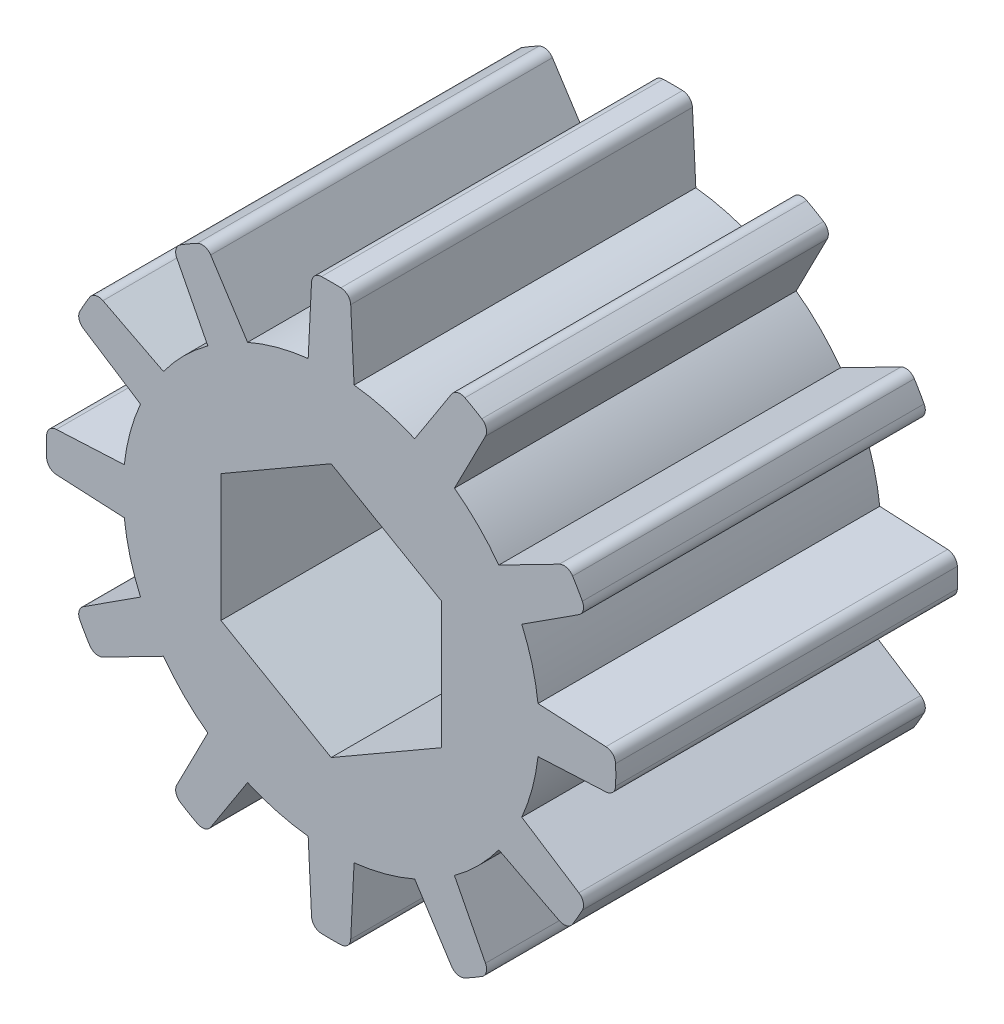
from build123d import *

# Parameters (mm, degrees)
CROQUIS1_R              = 1.85
SALIENTE_EXTRUIR1_DEPTH = 6.7
CORTAR_EXTRUIR3_DEPTH   = 11.352474398
REDONDEO1_R             = 0.2


with BuildPart() as part:
    # Croquis1 → Saliente-Extruir1 (new body)
    with BuildSketch(Plane.XY):
        with BuildLine():
            Line((0.375, 5.567875544), (0.45, 4.055600396))
            ThreePointArc((0.45, 4.055600396), (1.056108396, 3.941450193), (1.638088766, 3.737252971))
            Line((1.638088766, 3.737252971), (2.459178246, 5.009421667))
            ThreePointArc((2.459178246, 5.009421667), (2.790244751, 4.832845674), (3.108697299, 4.634421667))
            Line((3.108697299, 4.634421667), (2.41751163, 3.287252971))
            ThreePointArc((2.41751163, 3.287252971), (2.885341797, 2.885341797), (3.287252971, 2.41751163))
            Line((3.287252971, 2.41751163), (4.634421667, 3.108697299))
            ThreePointArc((4.634421667, 3.108697299), (4.832845674, 2.790244751), (5.009421667, 2.459178246))
            Line((5.009421667, 2.459178246), (3.737252971, 1.638088766))
            ThreePointArc((3.737252971, 1.638088766), (3.941450193, 1.056108396), (4.055600396, 0.45))
            Line((4.055600396, 0.45), (5.567875544, 0.375))
            ThreePointArc((5.567875544, 0.375), (5.580489502, 0), (5.567875544, -0.375))
            Line((5.567875544, -0.375), (4.055600396, -0.45))
            ThreePointArc((4.055600396, -0.45), (3.941450193, -1.056108396), (3.737252971, -1.638088766))
            Line((3.737252971, -1.638088766), (5.009421667, -2.459178246))
            ThreePointArc((5.009421667, -2.459178246), (4.832845674, -2.790244751), (4.634421667, -3.108697299))
            Line((4.634421667, -3.108697299), (3.287252971, -2.41751163))
            ThreePointArc((3.287252971, -2.41751163), (2.885341797, -2.885341797), (2.41751163, -3.287252971))
            Line((2.41751163, -3.287252971), (3.108697299, -4.634421667))
            ThreePointArc((3.108697299, -4.634421667), (2.790244751, -4.832845674), (2.459178246, -5.009421667))
            Line((2.459178246, -5.009421667), (1.638088766, -3.737252971))
            ThreePointArc((1.638088766, -3.737252971), (1.056108396, -3.941450193), (0.45, -4.055600396))
            Line((0.45, -4.055600396), (0.375, -5.567875544))
            ThreePointArc((0.375, -5.567875544), (0, -5.580489502), (-0.375, -5.567875544))
            Line((-0.375, -5.567875544), (-0.45, -4.055600396))
            ThreePointArc((-0.45, -4.055600396), (-1.056108396, -3.941450193), (-1.638088766, -3.737252971))
            Line((-1.638088766, -3.737252971), (-2.459178246, -5.009421667))
            ThreePointArc((-2.459178246, -5.009421667), (-2.790244751, -4.832845674), (-3.108697299, -4.634421667))
            Line((-3.108697299, -4.634421667), (-2.41751163, -3.287252971))
            ThreePointArc((-2.41751163, -3.287252971), (-2.885341797, -2.885341797), (-3.287252971, -2.41751163))
            Line((-3.287252971, -2.41751163), (-4.634421667, -3.108697299))
            ThreePointArc((-4.634421667, -3.108697299), (-4.832845674, -2.790244751), (-5.009421667, -2.459178246))
            Line((-5.009421667, -2.459178246), (-3.737252971, -1.638088766))
            ThreePointArc((-3.737252971, -1.638088766), (-3.941450193, -1.056108396), (-4.055600396, -0.45))
            Line((-4.055600396, -0.45), (-5.567875544, -0.375))
            ThreePointArc((-5.567875544, -0.375), (-5.580489502, 0), (-5.567875544, 0.375))
            Line((-5.567875544, 0.375), (-4.055600396, 0.45))
            ThreePointArc((-4.055600396, 0.45), (-3.941450193, 1.056108396), (-3.737252971, 1.638088766))
            Line((-3.737252971, 1.638088766), (-5.009421667, 2.459178246))
            ThreePointArc((-5.009421667, 2.459178246), (-4.832845674, 2.790244751), (-4.634421667, 3.108697299))
            Line((-4.634421667, 3.108697299), (-3.287252971, 2.41751163))
            ThreePointArc((-3.287252971, 2.41751163), (-2.885341797, 2.885341797), (-2.41751163, 3.287252971))
            Line((-2.41751163, 3.287252971), (-3.108697299, 4.634421667))
            ThreePointArc((-3.108697299, 4.634421667), (-2.790244751, 4.832845674), (-2.459178246, 5.009421667))
            Line((-2.459178246, 5.009421667), (-1.638088766, 3.737252971))
            ThreePointArc((-1.638088766, 3.737252971), (-1.056108396, 3.941450193), (-0.45, 4.055600396))
            Line((-0.45, 4.055600396), (-0.375, 5.567875544))
            ThreePointArc((-0.375, 5.567875544), (0, 5.580489502), (0.375, 5.567875544))
        make_face()
        Circle(CROQUIS1_R, mode=Mode.SUBTRACT)
    extrude(amount=SALIENTE_EXTRUIR1_DEPTH)

    # Croquis10 → Cortar-Extruir3 (cut, through all)
    with BuildSketch(Plane(origin=(0, 0, 0), x_dir=(-1, 0, 0), z_dir=(0, 0, -1))):
        Polygon((0, -2.494153163), (2.16, -1.247076581), (2.16, 1.247076581), (0, 2.494153163), (-2.16, 1.247076581), (-2.16, -1.247076581), align=None)
    extrude(amount=-CORTAR_EXTRUIR3_DEPTH, mode=Mode.SUBTRACT)

    # Redondeo1
    redondeo1_edges = [part.edges().sort_by_distance(p)[0] for p in [
        (5.567875544, -0.375, 3.35),
        (-2.459178246, -5.009421667, 3.35),
        (-3.108697299, -4.634421667, 3.35),
        (0.375, -5.567875544, 3.35),
        (-0.375, -5.567875544, 3.35),
        (3.108697299, -4.634421667, 3.35),
        (2.459178246, -5.009421667, 3.35),
        (5.009421667, -2.459178246, 3.35),
        (4.634421667, -3.108697299, 3.35),
        (-4.634421667, -3.108697299, 3.35),
        (-5.009421667, -2.459178246, 3.35),
        (-5.567875544, -0.375, 3.35),
        (-5.567875544, 0.375, 3.35),
        (-5.009421667, 2.459178246, 3.35),
        (-4.634421667, 3.108697299, 3.35),
        (-3.108697299, 4.634421667, 3.35),
        (-2.459178246, 5.009421667, 3.35),
        (5.567875544, 0.375, 3.35),
        (5.009421667, 2.459178246, 3.35),
        (4.634421667, 3.108697299, 3.35),
        (3.108697299, 4.634421667, 3.35),
        (2.459178246, 5.009421667, 3.35),
        (0.375, 5.567875544, 3.35),
        (-0.375, 5.567875544, 3.35),
    ]]
    fillet(redondeo1_edges, radius=REDONDEO1_R)


solid = part.part
